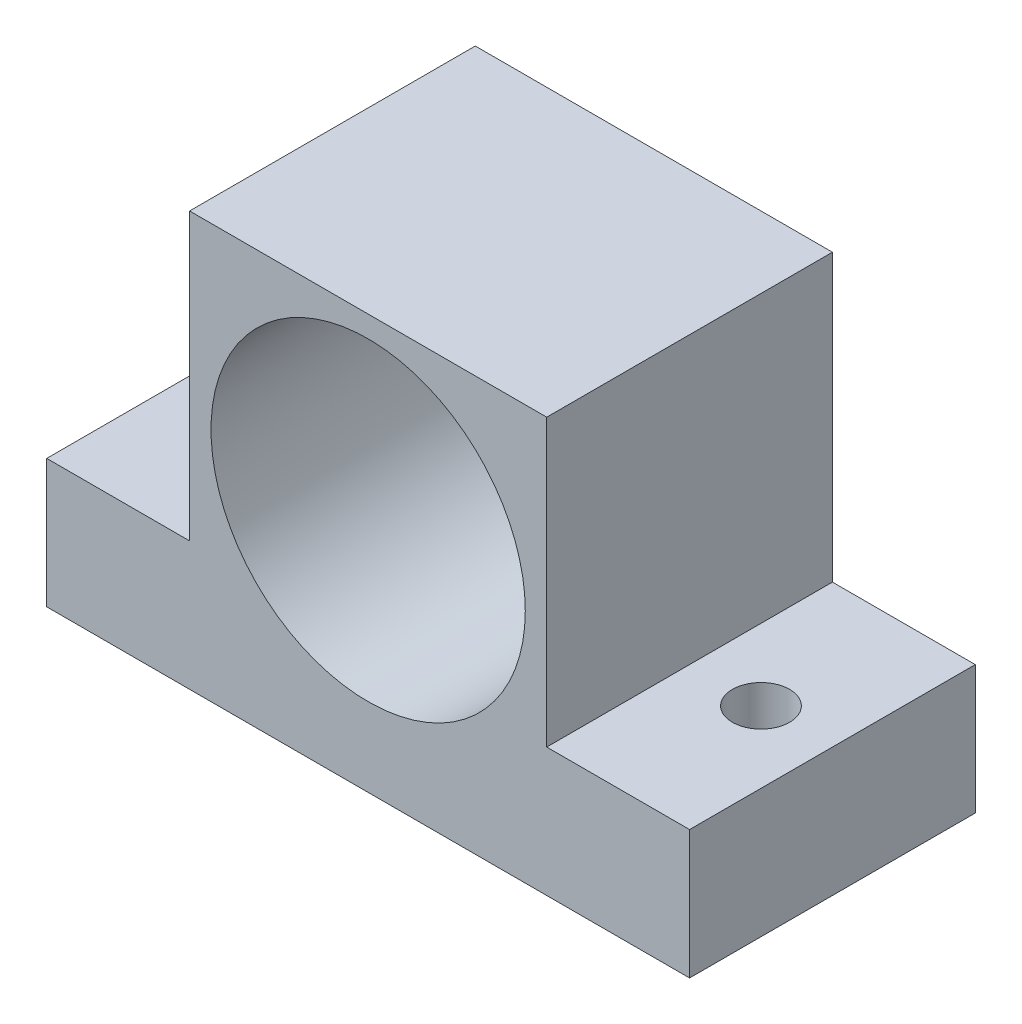
from build123d import *

# Parameters (mm, degrees)
SKETCH1_R           = 11
BOSS_EXTRUDE1_DEPTH = 20
SKETCH2_R           = 2
CUT_EXTRUDE1_DEPTH  = 9


with BuildPart() as part:
    # Sketch1 → Boss-Extrude1 (new body)
    with BuildSketch(Plane.XY):
        Polygon((12.5, 12.5), (-12.5, 12.5), (-12.5, -7.5), (-22.5, -7.5), (-22.5, -16.5), (22.5, -16.5), (22.5, -7.5), (12.5, -7.5), align=None)
        Circle(SKETCH1_R, mode=Mode.SUBTRACT)
    extrude(amount=BOSS_EXTRUDE1_DEPTH)

    # Sketch2 → Cut-Extrude1 (cut)
    with BuildSketch(Plane(origin=(0, -7.5, 0), x_dir=(1, 0, 0), z_dir=(0, 1, 0))):
        with Locations((-17.5, -10)):
            Circle(SKETCH2_R)
        with Locations((17.5, -10)):
            Circle(SKETCH2_R)
    extrude(amount=-CUT_EXTRUDE1_DEPTH, mode=Mode.SUBTRACT)


solid = part.part
